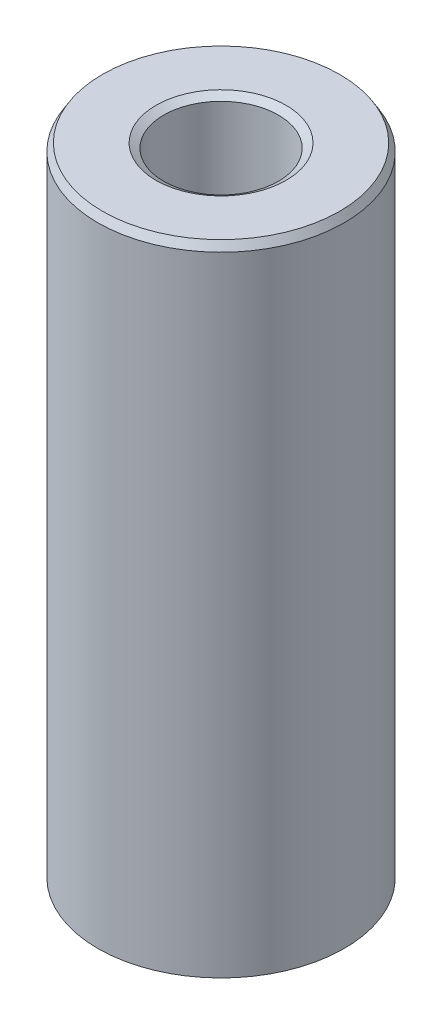
from build123d import *
from OCP.BRepFilletAPI import BRepFilletAPI_MakeChamfer

# Parameters (mm, degrees)
SKETCH1_R           = 7.5
BOSS_EXTRUDE1_DEPTH = 39.009800505
SKETCH2_R           = 3.493855138
CUT_EXTRUDE1_DEPTH  = 41.42603784
CHAMFER1_SIZE       = 0.46689048
CHAMFER1_SIZE2      = 0.280817784


with BuildPart() as part:
    # Sketch1 → Boss-Extrude1 (new body)
    with BuildSketch(Plane(origin=(0, 0, 0), x_dir=(1, 0, 0), z_dir=(0, 1, 0))):
        Circle(SKETCH1_R)
    extrude(amount=BOSS_EXTRUDE1_DEPTH)

    # Sketch2 → Cut-Extrude1 (cut, through all)
    with BuildSketch(Plane(origin=(0, 0, 0), x_dir=(1, 0, 0), z_dir=(0, 1, 0))):
        Circle(SKETCH2_R)
    extrude(amount=CUT_EXTRUDE1_DEPTH, mode=Mode.SUBTRACT)

    # Chamfer1: one chamfer whose edges measure the first distance from different faces: ONE call of the kernel's chamfer builder (chamfer() names one face for all edges)
    chamfer1_edges_1 = [part.edges().sort_by_distance(p)[0] for p in [
        (-3.493855138, 39.009800505, 0),
    ]]
    chamfer1_side_1 = [part.faces().sort_by_distance(p)[0] for p in [
        (-7.287867966, 39.009800505, 0),
    ]]
    chamfer1_edges_2 = [part.edges().sort_by_distance(p)[0] for p in [
        (-3.493855138, 0, 0),
    ]]
    chamfer1_side_2 = [part.faces().sort_by_distance(p)[0] for p in [
        (-3.493855138, 19.504900253, 0),
    ]]
    chamfer1_edges_3 = [part.edges().sort_by_distance(p)[0] for p in [
        (-7.5, 0, 0),
    ]]
    chamfer1_side_3 = [part.faces().sort_by_distance(p)[0] for p in [
        (-7.287867966, 0, 0),
    ]]
    chamfer1_edges_4 = [part.edges().sort_by_distance(p)[0] for p in [
        (-7.5, 39.009800505, 0),
    ]]
    chamfer1_side_4 = [part.faces().sort_by_distance(p)[0] for p in [
        (-7.5, 19.504900253, 0),
    ]]
    chamfer1 = BRepFilletAPI_MakeChamfer(part.part.solid().wrapped)
    for e in chamfer1_edges_1:
        chamfer1.Add(CHAMFER1_SIZE, CHAMFER1_SIZE2, e.wrapped, chamfer1_side_1[0].wrapped)  # the first distance lies on this face
    for e in chamfer1_edges_2:
        chamfer1.Add(CHAMFER1_SIZE, CHAMFER1_SIZE2, e.wrapped, chamfer1_side_2[0].wrapped)  # the first distance lies on this face
    for e in chamfer1_edges_3:
        chamfer1.Add(CHAMFER1_SIZE, CHAMFER1_SIZE2, e.wrapped, chamfer1_side_3[0].wrapped)  # the first distance lies on this face
    for e in chamfer1_edges_4:
        chamfer1.Add(CHAMFER1_SIZE, CHAMFER1_SIZE2, e.wrapped, chamfer1_side_4[0].wrapped)  # the first distance lies on this face
    add(Compound.cast(chamfer1.Shape()), mode=Mode.REPLACE)


solid = part.part
